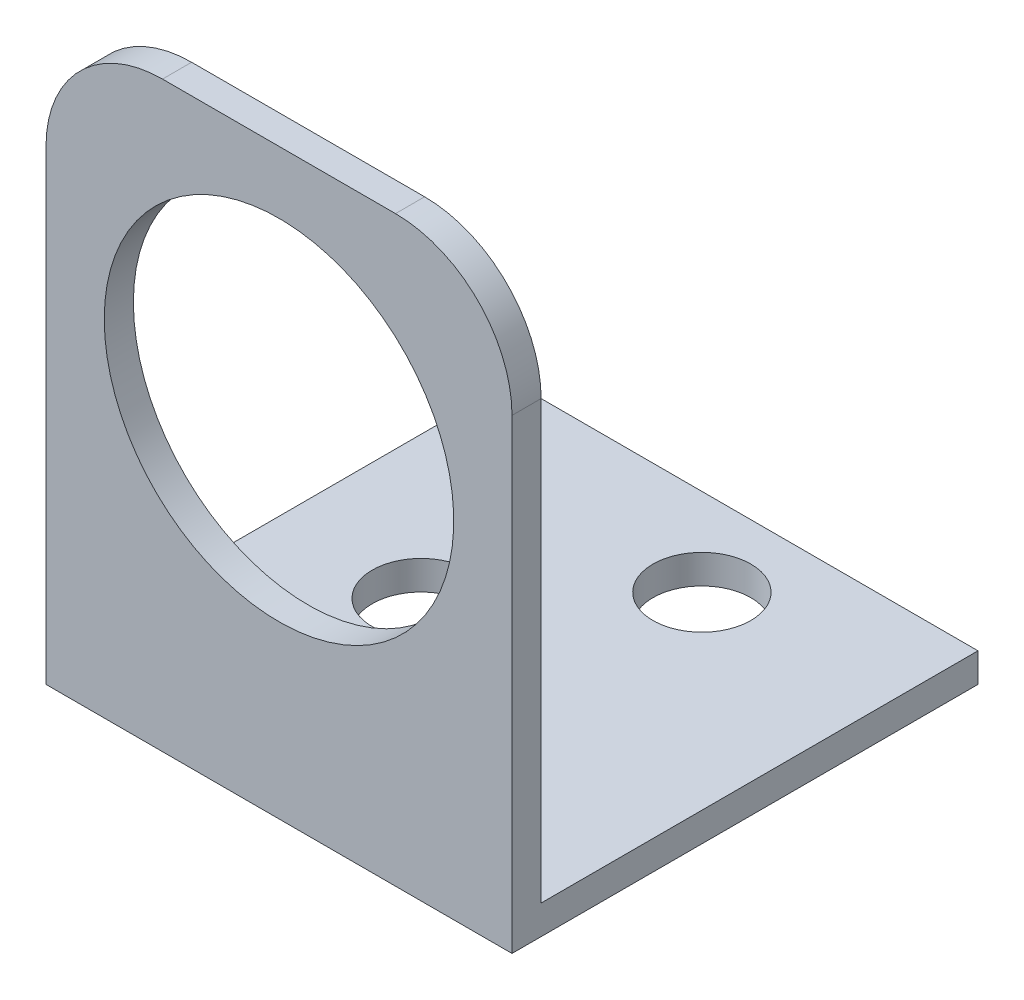
from build123d import *

# Parameters (mm, degrees)
BOSS_EXTRUDE1_DEPTH = 25.4
CUT_EXTRUDE1_REACH  = 49.12
SKETCH2_R           = 9.525
FILLET1_R           = 6.35
CUT_EXTRUDE2_REACH  = 49.941
SKETCH3_R           = 2.667


with BuildPart() as part:
    # Sketch1 → Boss-Extrude1 (new body)
    with BuildSketch(Plane(origin=(0, 0, 0), x_dir=(0, 0, -1), z_dir=(1, 0, 0))):
        Polygon((1.5875, 1.5875), (25.4, 1.5875), (25.4, 0), (0, 0), (0, 31.75), (1.5875, 31.75), align=None)
    extrude(amount=BOSS_EXTRUDE1_DEPTH)

    # Sketch2 → Cut-Extrude1 (cut, up to next)
    with BuildSketch(Plane(origin=(0, 0, -1.5875), x_dir=(-1, 0, 0), z_dir=(0, 0, -1)), mode=Mode.PRIVATE) as cut_extrude1_sk1:
        with Locations((-12.7, 18.830747356)):
            Circle(SKETCH2_R)
    cut_extrude1_tool1 = extrude(cut_extrude1_sk1.sketch, amount=-CUT_EXTRUDE1_REACH, mode=Mode.PRIVATE) & part.part
    add(cut_extrude1_tool1.solids().sort_by_distance((12.7, 18.830747, -1.5875))[0], mode=Mode.SUBTRACT)

    # Fillet1
    fillet1_edges = [part.edges().sort_by_distance(p)[0] for p in [
        (25.4, 31.75, -0.79375),
        (0, 31.75, -0.79375),
    ]]
    fillet(fillet1_edges, radius=FILLET1_R)

    # Sketch3 → Cut-Extrude2 (cut, up to next)
    with BuildSketch(Plane.XZ, mode=Mode.PRIVATE) as cut_extrude2_sk1:
        with Locations((15.113, -20.6375)):
            Circle(SKETCH3_R)
    cut_extrude2_tool1 = extrude(cut_extrude2_sk1.sketch, amount=-CUT_EXTRUDE2_REACH, mode=Mode.PRIVATE) & part.part
    # Sketch3 → Cut-Extrude2 (cut, up to next)
    with BuildSketch(Plane.XZ, mode=Mode.PRIVATE) as cut_extrude2_sk2:
        with Locations((7.747, -12.7)):
            Circle(SKETCH3_R)
    cut_extrude2_tool2 = extrude(cut_extrude2_sk2.sketch, amount=-CUT_EXTRUDE2_REACH, mode=Mode.PRIVATE) & part.part
    add(cut_extrude2_tool1.solids().sort_by_distance((15.113, 0, -20.6375))[0], mode=Mode.SUBTRACT)
    add(cut_extrude2_tool2.solids().sort_by_distance((7.747, 0, -12.7))[0], mode=Mode.SUBTRACT)


solid = part.part
